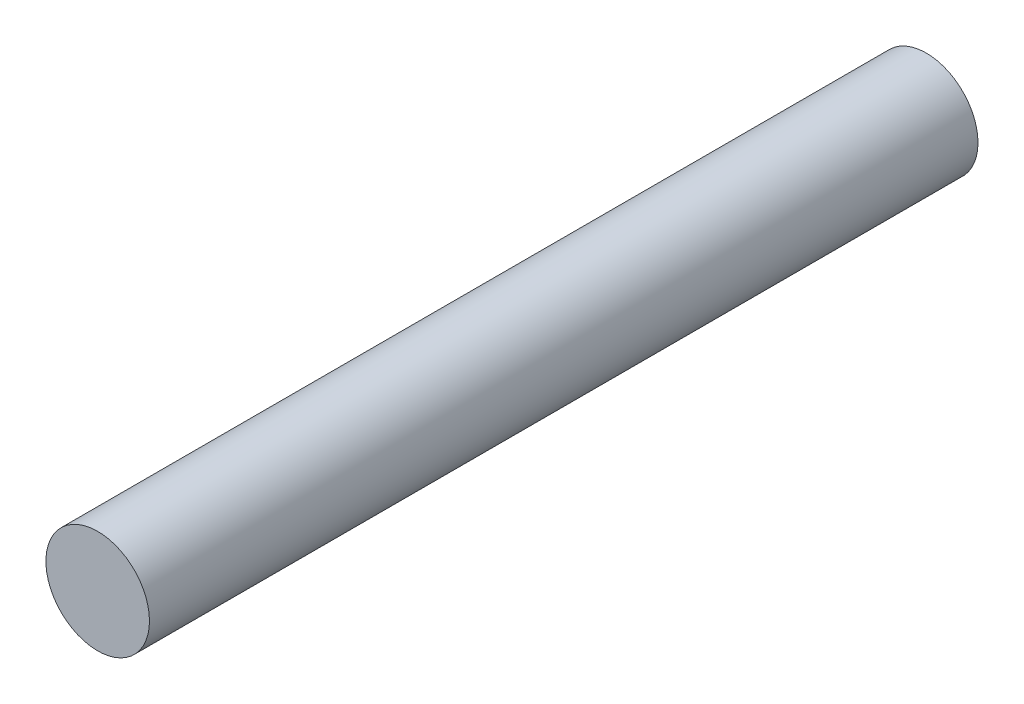
from build123d import *

# Parameters (mm, degrees)
SKIZZE1_R                       = 1.25
AUFSATZ_LINEAR_AUSTRAGEN1_DEPTH = 20


with BuildPart() as part:
    # Skizze1 → Aufsatz-Linear austragen1 (new body)
    with BuildSketch(Plane.XY):
        with Locations((-4.179870945, 1.247197002)):
            Circle(SKIZZE1_R)
    extrude(amount=AUFSATZ_LINEAR_AUSTRAGEN1_DEPTH)


solid = part.part
